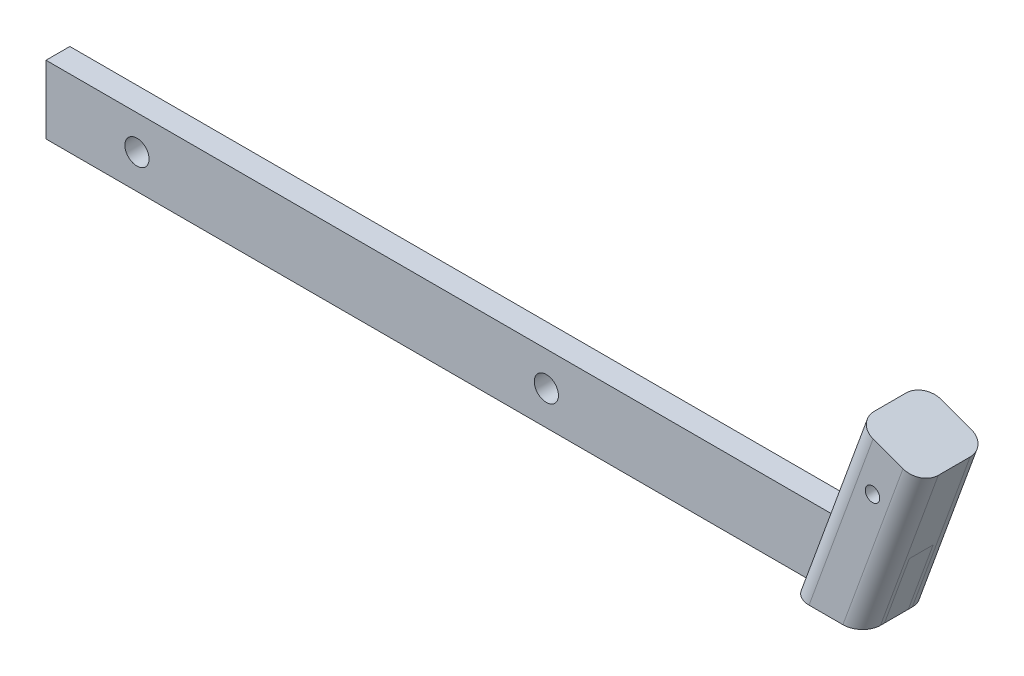
from build123d import *

# Parameters (mm, degrees)
BOSS_EXTRUDE2_REACH              = 80.351
SKETCH9_W                        = 19.05
SKETCH9_H                        = 19.05
F_10_32_TAPPED_HOLE1_D           = 4.0386
CUT_EXTRUDE2_REACH               = 260.043
SKETCH11_W                       = 6.6548
SKETCH11_H                       = 19.05
FILLET1_R                        = 5.08
BOSS_EXTRUDE3_REACH              = 260.043
SKETCH11_2_W                     = 6.6548
SKETCH11_2_H                     = 19.05
SKETCH17_W                       = 3.3782
SKETCH17_H                       = 12.8524
F_1_4_CLEARANCE_HOLE1_AT_2_COUNT = 2
F_1_4_CLEARANCE_HOLE1_AT_2_PITCH = 114.3


with BuildPart() as part:
    # Boss-Extrude2: up to this plane
    boss_extrude2_end = Plane(origin=(0, 0, 0), z_dir=(0, 1, 0))
    # Sketch9 → Boss-Extrude2 (new, up to the surface)
    with BuildSketch(Plane(origin=(17.334082407, 47.625, 0), x_dir=(0.939692620785907, -0.34202014332567254, 0), z_dir=(0.34202014332567254, 0.939692620785907, 0)), mode=Mode.PRIVATE) as boss_extrude2_sk1:
        Rectangle(SKETCH9_W, SKETCH9_H)
    boss_extrude2_tool1 = split(extrude(boss_extrude2_sk1.sketch, amount=-BOSS_EXTRUDE2_REACH, mode=Mode.PRIVATE), bisect_by=boss_extrude2_end, keep=Keep.BOTH, mode=Mode.PRIVATE)
    add(boss_extrude2_tool1.solids().sort_by_distance((17.334082, 47.625, 0))[0])

    # #10-32 Tapped Hole1 (through all)
    with Locations(Plane(origin=(0, 0, -9.525), x_dir=(-1, 0, 0), z_dir=(0, 0, -1))):
        with Locations((-12.990426587, 35.690903716)):
            Hole(F_10_32_TAPPED_HOLE1_D / 2)

    # Cut-Extrude2: up to this plane
    cut_extrude2_end = Plane(origin=(-0.559389402, -29.386146661, -9.525), z_dir=(0.939692620785907, -0.3420201433256725, 0))
    # Sketch11 → Cut-Extrude2 (cut, up to the surface)
    with BuildSketch(Plane.ZY.offset(223.965917593), mode=Mode.PRIVATE) as cut_extrude2_sk1:
        with Locations((0, 9.525)):
            Rectangle(SKETCH11_W, SKETCH11_H)
    cut_extrude2_tool1 = split(extrude(cut_extrude2_sk1.sketch, amount=-CUT_EXTRUDE2_REACH, mode=Mode.PRIVATE), bisect_by=cut_extrude2_end, keep=Keep.BOTH, mode=Mode.PRIVATE)
    add(cut_extrude2_tool1.solids().sort_by_distance((-223.965918, 9.525, 0))[0], mode=Mode.SUBTRACT)

    # Fillet1
    fillet1_edges = [part.edges().sort_by_distance(p)[0] for p in [
        (18.210473951, 22.183629067, 9.525),
        (-0.876391544, 25.441370933, 9.525),
        (-0.876391544, 25.441370933, -9.525),
        (18.210473951, 22.183629067, -9.525),
    ]]
    fillet(fillet1_edges, radius=FILLET1_R)


with BuildPart() as body_2:
    # Boss-Extrude3: up to this plane
    boss_extrude3_end = Plane(origin=(-0.559389402, -29.386146661, -9.525), z_dir=(0.939692620785907, -0.3420201433256725, 0))
    # Sketch11<2> → Boss-Extrude3 (new, up to the surface)
    with BuildSketch(Plane.ZY.offset(223.965917593), mode=Mode.PRIVATE) as boss_extrude3_sk1:
        with Locations((0, 9.525)):
            Rectangle(SKETCH11_2_W, SKETCH11_2_H)
    boss_extrude3_tool1 = split(extrude(boss_extrude3_sk1.sketch, amount=-BOSS_EXTRUDE3_REACH, mode=Mode.PRIVATE), bisect_by=boss_extrude3_end, keep=Keep.BOTH, mode=Mode.PRIVATE)
    add(boss_extrude3_tool1.solids().sort_by_distance((-223.965918, 9.525, 0))[0])

    # Sketch17 → 1/4 Clearance Hole1 (revolve, cut)
    with BuildSketch(Plane(origin=(-84.265917593, 9.525, -3.3274), x_dir=(0, 1, 0), z_dir=(1, 0, 0))):
        with Locations((1.6891, 6.4262)):
            Rectangle(SKETCH17_W, SKETCH17_H)
    f_1_4_clearance_hole1 = revolve(axis=Axis((-84.265917593, 9.525, -9.6774), (0, 0, 1)), mode=Mode.SUBTRACT)

    # 1/4 Clearance Hole1 at 2: 1/4 Clearance Hole1 ×2
    with Locations(*[(-i * F_1_4_CLEARANCE_HOLE1_AT_2_PITCH, 0, 0) for i in range(1, F_1_4_CLEARANCE_HOLE1_AT_2_COUNT)]):
        add(f_1_4_clearance_hole1, mode=Mode.SUBTRACT)


solid = Compound([part.part, body_2.part])
